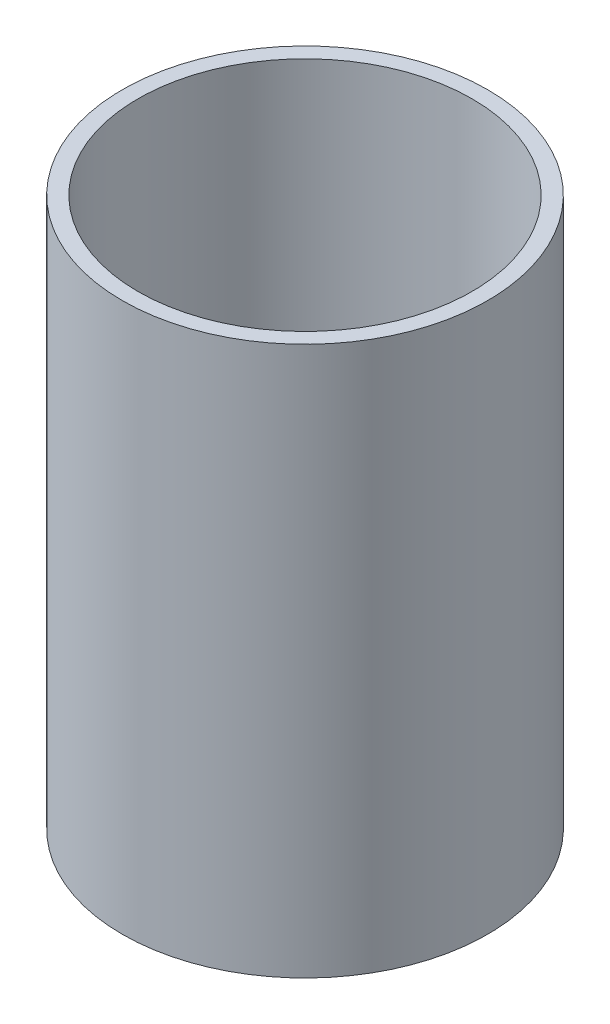
from build123d import *

# Parameters (mm, degrees)
SKETCH1_R           = 11.65
SKETCH1_R_2         = 10.65
BOSS_EXTRUDE1_DEPTH = 35


with BuildPart() as part:
    # Sketch1 → Boss-Extrude1 (new body)
    with BuildSketch(Plane(origin=(0, 0, 0), x_dir=(0.9991103154361699, 0, -0.04217318566384551), z_dir=(0, 1, 0))):
        with Locations((28.542888787, 18.957113921)):
            Circle(SKETCH1_R)
        with Locations((28.542888787, 18.957113921)):
            Circle(SKETCH1_R_2, mode=Mode.SUBTRACT)
    extrude(amount=BOSS_EXTRUDE1_DEPTH)


solid = part.part
